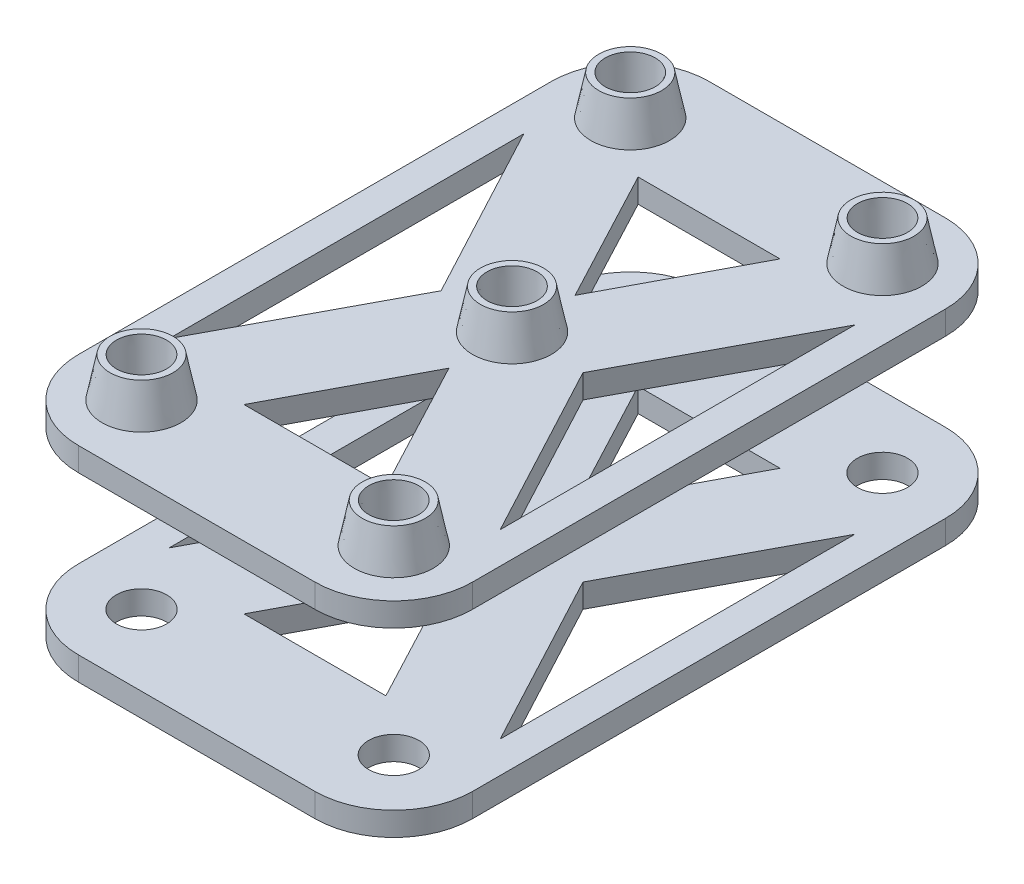
from build123d import *

# Parameters (mm, degrees)
SKETCH2_W           = 50
SKETCH2_H           = 80
BOSS_EXTRUDE1_DEPTH = 3
SKETCH3_R           = 5
SKETCH3_R_2         = 3
BOSS_EXTRUDE2_DEPTH = 5
CHAMFER1_SIZE       = 5
CHAMFER1_SIZE_2     = 1
CUT_EXTRUDE1_DEPTH  = 3
FILLET1_R           = 10
DRAFT3_ANGLE        = 2
SKETCH5_W           = 50
SKETCH5_H           = 80
CUT_EXTRUDE2_DEPTH  = 5
SKETCH6_R           = 3.2
CUT_EXTRUDE4_DEPTH  = 3


with BuildPart() as part:
    # Sketch2 → Boss-Extrude1 (new body)
    with BuildSketch(Plane(origin=(0, 0, 0), x_dir=(1, 0, 0), z_dir=(0, 1, 0))):
        Rectangle(SKETCH2_W, SKETCH2_H)
    extrude(amount=-BOSS_EXTRUDE1_DEPTH)

    # Sketch3 → Boss-Extrude2 (add)
    # profile 1 of 5: a face of its own
    with BuildSketch(Plane(origin=(0, 0, 0), x_dir=(1, 0, 0), z_dir=(0, 1, 0))):
        with Locations(Location((-16, 31, 0), (0, 0, 270))):
            Circle(SKETCH3_R)
        with Locations(Location((-16, 31, 0), (0, 0, 270))):
            Circle(SKETCH3_R_2, mode=Mode.SUBTRACT)
    # profile 2 of 5: a face of its own
    with BuildSketch(Plane(origin=(0, 0, 0), x_dir=(1, 0, 0), z_dir=(0, 1, 0))):
        with Locations(Location((16, 31, 0), (0, 0, 90))):
            Circle(SKETCH3_R)
        with Locations(Location((16, 31, 0), (0, 0, 90))):
            Circle(SKETCH3_R_2, mode=Mode.SUBTRACT)
    # profile 3 of 5: a face of its own
    with BuildSketch(Plane(origin=(0, 0, 0), x_dir=(1, 0, 0), z_dir=(0, 1, 0))):
        with Locations(Location((16, -31, 0), (0, 0, 270))):
            Circle(SKETCH3_R)
        with Locations(Location((16, -31, 0), (0, 0, 270))):
            Circle(SKETCH3_R_2, mode=Mode.SUBTRACT)
    # profile 4 of 5: a face of its own
    with BuildSketch(Plane(origin=(0, 0, 0), x_dir=(1, 0, 0), z_dir=(0, 1, 0))):
        with Locations(Location((-16, -31, 0), (0, 0, 90))):
            Circle(SKETCH3_R)
        with Locations(Location((-16, -31, 0), (0, 0, 90))):
            Circle(SKETCH3_R_2, mode=Mode.SUBTRACT)
    # profile 5 of 5: a face of its own
    with BuildSketch(Plane(origin=(0, 0, 0), x_dir=(1, 0, 0), z_dir=(0, 1, 0))):
        with Locations(Location((0, 0, 0), (0, 0, 270))):
            Circle(SKETCH3_R)
        with Locations(Location((0, 0, 0), (0, 0, 270))):
            Circle(SKETCH3_R_2, mode=Mode.SUBTRACT)
    extrude(amount=BOSS_EXTRUDE2_DEPTH)

    # Chamfer1
    # the kernel refuses this chamfer: 5, 1 mm, written as the material it takes off along each edge
    with BuildSketch(Plane(origin=(-16, 5, -31), x_dir=(0, 0, 1), z_dir=(-1, 0, 0))) as chamfer1_piece_1_section:
        Polygon((5, -CHAMFER1_SIZE), (5 - CHAMFER1_SIZE_2, 0), (5, 0), align=None)
    chamfer1_piece_1 = revolve(axis=Axis((-16, 5, -31), (0, 1, 0)), mode=Mode.PRIVATE)
    chamfer1_piece_1 = split(chamfer1_piece_1, bisect_by=Plane(origin=(-16, 0, -35.524949773), z_dir=(0, 1, 0)), keep=Keep.TOP, mode=Mode.PRIVATE)
    add(chamfer1_piece_1, mode=Mode.SUBTRACT)
    with BuildSketch(Plane(origin=(16, 5, -31), x_dir=(0, 0, -1), z_dir=(1, 0, 0))) as chamfer1_piece_2_section:
        Polygon((5, -CHAMFER1_SIZE), (5 - CHAMFER1_SIZE_2, 0), (5, 0), align=None)
    chamfer1_piece_2 = revolve(axis=Axis((16, 5, -31), (0, 1, 0)), mode=Mode.PRIVATE)
    chamfer1_piece_2 = split(chamfer1_piece_2, bisect_by=Plane(origin=(16, 0, -26.475050227), z_dir=(0, 1, 0)), keep=Keep.TOP, mode=Mode.PRIVATE)
    add(chamfer1_piece_2, mode=Mode.SUBTRACT)
    with BuildSketch(Plane(origin=(16, 5, 31), x_dir=(0, 0, 1), z_dir=(-1, 0, 0))) as chamfer1_piece_3_section:
        Polygon((5, -CHAMFER1_SIZE), (5 - CHAMFER1_SIZE_2, 0), (5, 0), align=None)
    chamfer1_piece_3 = revolve(axis=Axis((16, 5, 31), (0, 1, 0)), mode=Mode.PRIVATE)
    chamfer1_piece_3 = split(chamfer1_piece_3, bisect_by=Plane(origin=(16, 0, 26.475050227), z_dir=(0, 1, 0)), keep=Keep.TOP, mode=Mode.PRIVATE)
    add(chamfer1_piece_3, mode=Mode.SUBTRACT)
    with BuildSketch(Plane(origin=(-16, 5, 31), x_dir=(0, 0, -1), z_dir=(1, 0, 0))) as chamfer1_piece_4_section:
        Polygon((5, -CHAMFER1_SIZE), (5 - CHAMFER1_SIZE_2, 0), (5, 0), align=None)
    chamfer1_piece_4 = revolve(axis=Axis((-16, 5, 31), (0, 1, 0)), mode=Mode.PRIVATE)
    chamfer1_piece_4 = split(chamfer1_piece_4, bisect_by=Plane(origin=(-16, 0, 35.524949773), z_dir=(0, 1, 0)), keep=Keep.TOP, mode=Mode.PRIVATE)
    add(chamfer1_piece_4, mode=Mode.SUBTRACT)
    with BuildSketch(Plane(origin=(0, 5, 0), x_dir=(0, 0, 1), z_dir=(-1, 0, 0))) as chamfer1_piece_5_section:
        Polygon((5, -CHAMFER1_SIZE), (5 - CHAMFER1_SIZE_2, 0), (5, 0), align=None)
    chamfer1_piece_5 = revolve(axis=Axis((0, 5, 0), (0, 1, 0)), mode=Mode.PRIVATE)
    chamfer1_piece_5 = split(chamfer1_piece_5, bisect_by=Plane(origin=(0, 0, -4.524949773), z_dir=(0, 1, 0)), keep=Keep.TOP, mode=Mode.PRIVATE)
    add(chamfer1_piece_5, mode=Mode.SUBTRACT)

    # Sketch4 → Cut-Extrude1 (cut)
    with BuildSketch(Plane(origin=(0, 0, 0), x_dir=(1, 0, 0), z_dir=(0, 1, 0))):
        Polygon((-21, 22.5), (-21, -22.5), (-9, 0), align=None)
        Polygon((9, 0), (21, 22.5), (21, -22.5), align=None)
        Polygon((0, 8), (9, 25), (-9, 25), align=None)
        Polygon((0, -8), (9, -25), (-9, -25), align=None)
    extrude(amount=-CUT_EXTRUDE1_DEPTH, mode=Mode.SUBTRACT)

    # Fillet1
    fillet1_edges = [part.edges().sort_by_distance(p)[0] for p in [
        (-25, -1.5, -40),
        (25, -1.5, -40),
        (25, -1.5, 40),
        (-25, -1.5, 40),
    ]]
    fillet(fillet1_edges, radius=FILLET1_R)

    # Draft3
    draft3_faces = [part.faces().sort_by_distance(p)[0] for p in [
        (16, 2.5, -28),
        (-16, 2.5, -34),
        (-16, 2.5, 34),
        (0, 2.5, -3),
        (16, 2.5, 28),
    ]]
    draft(draft3_faces, Plane.ZX, DRAFT3_ANGLE)


with BuildPart() as body_2:
    # Mirror5: mirrored copy
    add(part.part.mirror(Plane(origin=(0, -13, 0), x_dir=(0, 0, 1), z_dir=(0, -1, 0))))

    # Sketch5 → Cut-Extrude2 (cut)
    with BuildSketch(Plane.XZ.offset(31)):
        Rectangle(SKETCH5_W, SKETCH5_H)
    extrude(amount=-CUT_EXTRUDE2_DEPTH, mode=Mode.SUBTRACT)

    # Sketch6 → Cut-Extrude4 (cut)
    with BuildSketch(Plane.XZ.offset(26)):
        with Locations(Location((-16, 31, 0), (0, 0, 270))):
            Circle(SKETCH6_R)
        with Locations(Location((0, 0, 0), (0, 0, 270))):
            Circle(SKETCH6_R)
        with Locations(Location((-16, -31, 0), (0, 0, 270))):
            Circle(SKETCH6_R)
        with Locations(Location((16, 31, 0), (0, 0, 270))):
            Circle(SKETCH6_R)
        with Locations(Location((16, -31, 0), (0, 0, 270))):
            Circle(SKETCH6_R)
    extrude(amount=-CUT_EXTRUDE4_DEPTH, mode=Mode.SUBTRACT)


solid = Compound([part.part, body_2.part])
